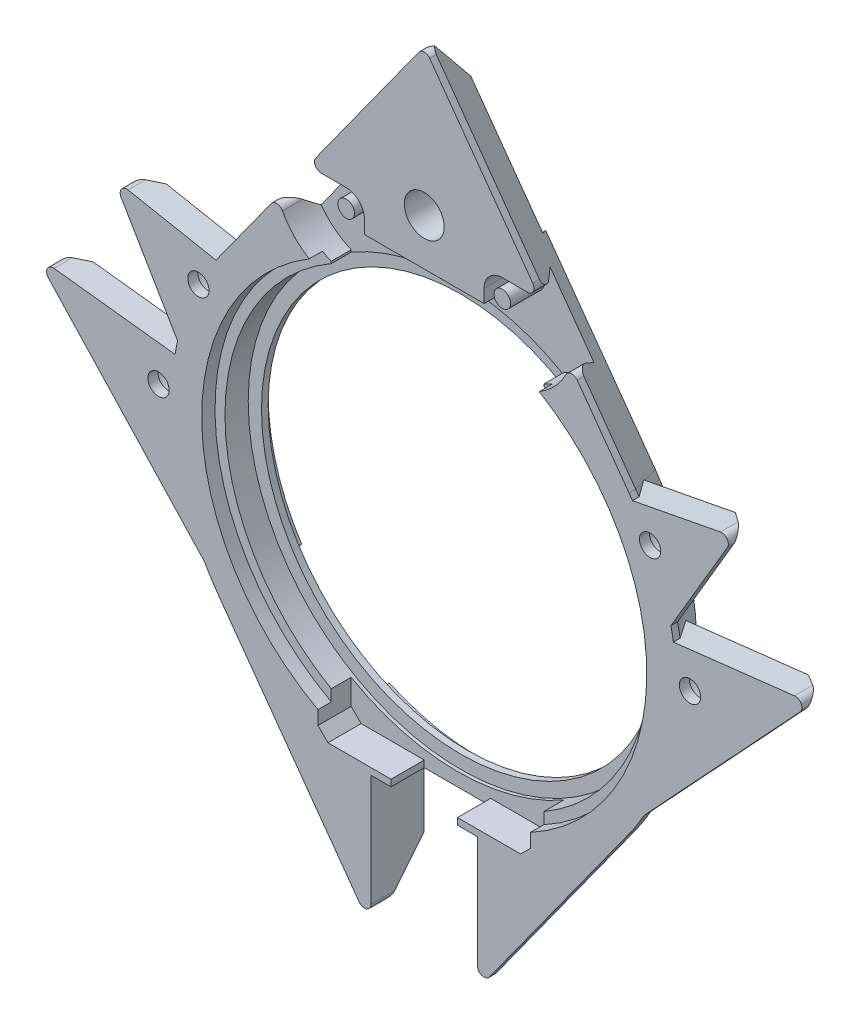
from build123d import *

# Parameters (mm, degrees)
SKETCH_1_R                = 30
EXTRUDE_1_DEPTH           = 8
CHAMFER_12_SIZE           = 7
CHAMFER_12_SIZE_2         = 5
SKETCH_11_R               = 31.5
CUT_EXTRUDE_1_DEPTH       = 1.5
EXTRUDE_5_DEPTH           = 4
EXTRUDE_5_2_DEPTH         = 4
EXTRUDE_5_3_DEPTH         = 4
EXTRUDE_5_4_DEPTH         = 4
CHAMFER_13_SIZE           = 3
CHAMFER_14_SIZE           = 3
CHAMFER_15_SIZE           = 3
CHAMFER_16_SIZE           = 3
SKETCH_36_W               = 32
SKETCH_36_H               = 70
CUT_EXTRUDE_17_DEPTH      = 5
SKETCH_13_W               = 16
SKETCH_13_H               = 31
CUT_EXTRUDE_2_DEPTH       = 87.190822204
SKETCH_24_R               = 32
CUT_EXTRUDE_8_DEPTH       = 5.5
CHAMFER_20_SIZE           = 2.5
CUT_EXTRUDE_19_REACH      = 88.191
SKETCH_37_R               = 1.5
SKETCH_37_R_2             = 1.25
CUT_EXTRUDE_9_DEPTH       = 86.911919035
CUT_EXTRUDE_9_DEPTH_BACK  = 2.5
SKETCH_25_R               = 3.5
HOLE_WIZARD_3_2_3_2_1_D   = 3.2
CUT_EXTRUDE_14_DEPTH      = 1
SKETCH_34_R               = 35
SKETCH_34_R_2             = 17.5
CUT_EXTRUDE_15_DEPTH      = 1
FILLET_1_R                = 1
SKETCH_38_W               = 9.5
SKETCH_38_H               = 1
EXTRUDE_6_DEPTH           = 5
CUT_EXTRUDE_20_DEPTH      = 87.10376201
CUT_EXTRUDE_20_DEPTH_BACK = 87.10376201
SKETCH_39_R               = 3
CHAMFER_21_SIZE           = 2
CUT_EXTRUDE_21_DEPTH      = 2
FILLET_2_R                = 1


with BuildPart() as part:
    # Эскиз1 → Бобышка-Вытянуть1 (new body)
    with BuildSketch(Plane.XY):
        with BuildLine():
            Line((30.829801919, 22.215384615), (0.811310577, 63.874089069))
            ThreePointArc((0.811310577, 63.874089069), (0, 64.289473684), (-0.811310577, 63.874089069))
            Line((-0.811310577, 63.874089069), (-30.829801919, 22.215384615))
            ThreePointArc((-30.829801919, 22.215384615), (-38, 0), (-30.829801919, -22.215384615))
            Line((-30.829801919, -22.215384615), (-0.811310577, -63.874089069))
            ThreePointArc((-0.811310577, -63.874089069), (0, -64.289473684), (0.811310577, -63.874089069))
            Line((0.811310577, -63.874089069), (30.829801919, -22.215384615))
            ThreePointArc((30.829801919, -22.215384615), (38, 0), (30.829801919, 22.215384615))
        make_face()
        Circle(SKETCH_1_R, mode=Mode.SUBTRACT)
    extrude(amount=EXTRUDE_1_DEPTH)

    # Фаска12
    # the kernel refuses this chamfer: 7, 5 mm, written as the material it takes off along each edge
    with BuildSketch(Plane(origin=(-30.829801919, -22.215384615, 0), x_dir=(-0.018263348031143992, -0.013160230543711323, 0.9997465971188547), z_dir=(0.5846153846153845, -0.8113105768267822, 0)), Plane(origin=(-9.755140998, -78.537873409, 0), x_dir=(0.018263348031143826, -0.013160230543711206, 0.9997465971188547), z_dir=(0.5846153846153846, 0.8113105768267822, 0)), Plane(origin=(9.755140998, 78.537873409, 0), x_dir=(-0.018263348031143992, 0.013160230543711323, 0.9997465971188547), z_dir=(-0.5846153846153845, -0.8113105768267822, 0)), Plane(origin=(30.829801919, 22.215384615, 0), x_dir=(0.018263348031143992, 0.013160230543711323, 0.9997465971188547), z_dir=(-0.5846153846153846, 0.8113105768267822, 0))) as chamfer_12_piece_1:
        Polygon((CHAMFER_12_SIZE * 0.999746597119, -CHAMFER_12_SIZE * 0.0225109206669), (-CHAMFER_12_SIZE_2 * 0.0225109206669, -CHAMFER_12_SIZE_2 * 0.999746597119), (0, 0), align=None)
    extrude(amount=69.421612884, mode=Mode.SUBTRACT)
    with BuildSketch(Plane(origin=(0, 0, 0), x_dir=(0.8113105768267822, -0.5846153846153845, 0), z_dir=(-0.5846153846153845, -0.8113105768267822, 0))) as chamfer_12_piece_2:
        Polygon((38, CHAMFER_12_SIZE), (38 - CHAMFER_12_SIZE_2, 0), (38, 0), align=None)
    revolve(axis=Axis((0, 0, 0), (0, 0, 1)), revolution_arc=71.551646689, mode=Mode.SUBTRACT)
    with BuildSketch(Plane(origin=(0, 0, 0), x_dir=(-0.8113105768267816, 0.5846153846153853, 0), z_dir=(0.5846153846153853, 0.8113105768267816, 0))) as chamfer_12_piece_3:
        Polygon((38, CHAMFER_12_SIZE), (38 - CHAMFER_12_SIZE_2, 0), (38, 0), align=None)
    revolve(axis=Axis((0, 0, 0), (0, 0, 1)), revolution_arc=71.551646689, mode=Mode.SUBTRACT)

    # Эскиз11 → Вырез-Вытянуть1 (cut)
    with BuildSketch(Plane(origin=(0, 0, 0), x_dir=(-1, 0, 0), z_dir=(0, 0, -1))):
        Circle(SKETCH_11_R)
    extrude(amount=-CUT_EXTRUDE_1_DEPTH, mode=Mode.SUBTRACT)


with BuildPart() as body_2:
    # Эскиз17 → Бобышка-Вытянуть5 (new body)
    with BuildSketch(Plane(origin=(0, 0, 8), x_dir=(-1, 0, 0), z_dir=(0, 0, -1))):
        with BuildLine():
            Line((27.658633372, -18), (31.430265195, -20.454545455))
            Line((31.430265195, -20.454545455), (56.580125307, 6.558267258))
            ThreePointArc((56.580125307, 6.558267258), (56.740609868, 7.690973443), (55.733168502, 8.233044002))
            Line((55.733168502, 8.233044002), (32.530722923, 5.545454545))
            ThreePointArc((32.530722923, 5.545454545), (32.315426041, -6.686795927), (27.658633372, -18))
        make_face()
    extrude(amount=EXTRUDE_5_DEPTH)

    # Фаска13
    # the kernel refuses this chamfer: 3 mm, written as the material it takes off along each edge
    with BuildSketch(Plane(origin=(-26.173087888, -26.101143304, 4), x_dir=(-0.020124066412995686, -0.01873619976382356, 0.9996219169112968), z_dir=(-0.6814185279188427, 0.73189397443135, 0))) as chamfer_13_piece_1:
        Polygon((CHAMFER_13_SIZE * 0.999621916911, CHAMFER_13_SIZE * 0.0274958766106), (-CHAMFER_13_SIZE * 0.0274958766106, CHAMFER_13_SIZE * 0.999621916911), (0, 0), align=None)
    extrude(amount=52.338193439, mode=Mode.SUBTRACT)


with BuildPart() as body_3:
    # Эскиз17 → Extrude 5 2 (new body)
    with BuildSketch(Plane(origin=(0, 0, 8), x_dir=(-1, 0, 0), z_dir=(0, 0, -1))):
        with BuildLine():
            Line((-31.430265195, -20.454545455), (-27.658633372, -18))
            ThreePointArc((-27.658633372, -18), (-32.315426041, -6.686795927), (-32.530722923, 5.545454545))
            Line((-32.530722923, 5.545454545), (-55.733168502, 8.233044002))
            ThreePointArc((-55.733168502, 8.233044002), (-56.740609868, 7.690973443), (-56.580125307, 6.558267258))
            Line((-56.580125307, 6.558267258), (-31.430265195, -20.454545455))
        make_face()
    extrude(amount=EXTRUDE_5_2_DEPTH)

    # Фаска14
    # the kernel refuses this chamfer: 3 mm, written as the material it takes off along each edge
    with BuildSketch(Plane(origin=(61.837302615, 12.204865107, 4), x_dir=(0.02012406641299663, -0.018736199763824447, 0.9996219169112968), z_dir=(-0.6814185279188428, -0.7318939744313497, 0))) as chamfer_14_piece_1:
        Polygon((CHAMFER_14_SIZE * 0.999621916911, CHAMFER_14_SIZE * 0.0274958766106), (-CHAMFER_14_SIZE * 0.0274958766106, CHAMFER_14_SIZE * 0.999621916911), (0, 0), align=None)
    extrude(amount=52.338193439, mode=Mode.SUBTRACT)


with BuildPart() as body_4:
    # Эскиз17 → Extrude 5 3 (new body)
    with BuildSketch(Plane(origin=(0, 0, 8), x_dir=(-1, 0, 0), z_dir=(0, 0, -1))):
        with BuildLine():
            ThreePointArc((25.909216128, 20.438016529), (29.943619234, 13.870099754), (32.34435074, 6.545454545))
            Line((32.34435074, 6.545454545), (36.754944023, 7.438016529))
            Line((36.754944023, 7.438016529), (45.633903711, 22.532247998))
            ThreePointArc((45.633903711, 22.532247998), (45.589131135, 23.615676709), (44.583521637, 24.021351321))
            Line((44.583521637, 24.021351321), (25.909216128, 20.438016529))
        make_face()
    extrude(amount=EXTRUDE_5_3_DEPTH)

    # Фаска16
    # the kernel refuses this chamfer: 3 mm, written as the material it takes off along each edge
    with BuildSketch(Plane(origin=(-32.843258921, 0.788151855, 4), x_dir=(-0.02369963682641979, -0.013940962839070477, 0.9996219169112968), z_dir=(-0.5070201265633943, 0.8619342151577694, 0))) as chamfer_16_piece_1:
        Polygon((CHAMFER_16_SIZE * 0.999621916911, CHAMFER_16_SIZE * 0.0274958766106), (-CHAMFER_16_SIZE * 0.0274958766106, CHAMFER_16_SIZE * 0.999621916911), (0, 0), align=None)
    extrude(amount=32.942143747, mode=Mode.SUBTRACT)


with BuildPart() as body_5:
    # Эскиз17 → Extrude 5 4 (new body)
    with BuildSketch(Plane(origin=(0, 0, 8), x_dir=(-1, 0, 0), z_dir=(0, 0, -1))):
        with BuildLine():
            Line((-36.754944023, 7.438016529), (-32.34435074, 6.545454545))
            ThreePointArc((-32.34435074, 6.545454545), (-29.943619234, 13.870099754), (-25.909216128, 20.438016529))
            Line((-25.909216128, 20.438016529), (-44.583521637, 24.021351321))
            ThreePointArc((-44.583521637, 24.021351321), (-45.589131135, 23.615676709), (-45.633903711, 22.532247998))
            Line((-45.633903711, 22.532247998), (-36.754944023, 7.438016529))
        make_face()
    extrude(amount=EXTRUDE_5_4_DEPTH)

    # Фаска15
    # the kernel refuses this chamfer: 3 mm, written as the material it takes off along each edge
    with BuildSketch(Plane(origin=(49.545588813, 29.182112672, 4), x_dir=(0.02369963682642022, -0.013940962839070741, 0.9996219169112968), z_dir=(-0.5070201265633945, -0.8619342151577692, 0))) as chamfer_15_piece_1:
        Polygon((CHAMFER_15_SIZE * 0.999621916911, CHAMFER_15_SIZE * 0.0274958766106), (-CHAMFER_15_SIZE * 0.0274958766106, CHAMFER_15_SIZE * 0.999621916911), (0, 0), align=None)
    extrude(amount=32.942143747, mode=Mode.SUBTRACT)


with BuildPart() as body_2_1:
    add(body_2.part)

    # Combine 2: union body 3, body 5, body 4, part
    add(body_3.part)
    add(body_5.part)
    add(body_4.part)
    add(part.part)

    # Эскиз36 → Вырез-Вытянуть17 (cut)
    with BuildSketch(Plane.XY.offset(8)):
        with Locations((0, 1)):
            Rectangle(SKETCH_36_W, SKETCH_36_H)
    extrude(amount=-CUT_EXTRUDE_17_DEPTH, mode=Mode.SUBTRACT)

    # Эскиз13 → Вырез-Вытянуть2 (cut, through all)
    with BuildSketch(Plane.XY.offset(8)):
        with Locations((0, -49.5)):
            Rectangle(SKETCH_13_W, SKETCH_13_H)
    extrude(amount=-CUT_EXTRUDE_2_DEPTH, mode=Mode.SUBTRACT)

    # Эскиз24 → Вырез-Вытянуть8 (cut)
    with BuildSketch(Plane.XY.offset(8)):
        with Locations(Location((0, 0, 0), (0, 0, 60))):
            Circle(SKETCH_24_R)
    extrude(amount=-CUT_EXTRUDE_8_DEPTH, mode=Mode.SUBTRACT)

    # Фаска20
    chamfer_20_edges = [body_2_1.edges().sort_by_distance(p)[0] for p in [
        (16, -34, 5.5),
        (16, 36, 5.5),
        (-16, 36, 5.5),
        (-16, -34, 5.5),
    ]]
    chamfer(chamfer_20_edges, length=CHAMFER_20_SIZE)

    # Вырез-Вытянуть19: up to this face of the body (flat: up to its plane)
    cut_extrude_19_end = Plane(body_2_1.part.faces().sort_by_distance((0, 33.081879447, 3))[0])
    # Эскиз37 → Вырез-Вытянуть19 (cut, up to the picked face)
    with BuildSketch(Plane.XY.offset(8), mode=Mode.PRIVATE) as cut_extrude_19_sk1:
        with BuildLine():
            Line((17.474101142, 40.75), (11.75, 40.75))
            ThreePointArc((11.75, 40.75), (13.694543648, 39.944543648), (14.5, 38))
            ThreePointArc((14.5, 38), (14.255512428, 36.866462407), (13.565521837, 35.934478163))
            Line((13.565521837, 35.934478163), (16, 33.5))
            Line((16, 33.5), (16, 28.012507822))
            ThreePointArc((16, 28.012507822), (19.687902157, 30.597148566), (22.009323549, 34.456163053))
            Line((22.009323549, 34.456163053), (17.474101142, 40.75))
        make_face()
    cut_extrude_19_tool1 = split(extrude(cut_extrude_19_sk1.sketch, amount=-CUT_EXTRUDE_19_REACH, mode=Mode.PRIVATE), bisect_by=cut_extrude_19_end, keep=Keep.BOTH, mode=Mode.PRIVATE)
    # Эскиз37 → Вырез-Вытянуть19 (cut, up to the picked face)
    with BuildSketch(Plane.XY.offset(8), mode=Mode.PRIVATE) as cut_extrude_19_sk2:
        with BuildLine():
            Line((9.862541391, 36), (9, 36))
            Line((9, 36), (9, 27.5))
            ThreePointArc((9, 27.5), (12.542569282, 27.174828688), (16, 28.012507822))
            Line((16, 28.012507822), (16, 33.5))
            Line((16, 33.5), (13.565521837, 35.934478163))
            ThreePointArc((13.565521837, 35.934478163), (11.701348149, 35.250430398), (9.862541391, 36))
        make_face()
    cut_extrude_19_tool2 = split(extrude(cut_extrude_19_sk2.sketch, amount=-CUT_EXTRUDE_19_REACH, mode=Mode.PRIVATE), bisect_by=cut_extrude_19_end, keep=Keep.BOTH, mode=Mode.PRIVATE)
    # Эскиз37 → Вырез-Вытянуть19 (cut, up to the picked face)
    with BuildSketch(Plane.XY.offset(8), mode=Mode.PRIVATE) as cut_extrude_19_sk3:
        with BuildLine():
            Line((9, 38), (9, 36))
            Line((9, 36), (9.862541391, 36))
            ThreePointArc((9.862541391, 36), (9.224825632, 36.910966294), (9, 38))
        make_face()
    cut_extrude_19_tool3 = split(extrude(cut_extrude_19_sk3.sketch, amount=-CUT_EXTRUDE_19_REACH, mode=Mode.PRIVATE), bisect_by=cut_extrude_19_end, keep=Keep.BOTH, mode=Mode.PRIVATE)
    # Эскиз37 → Вырез-Вытянуть19 (cut, up to the picked face)
    with BuildSketch(Plane.XY.offset(8), mode=Mode.PRIVATE) as cut_extrude_19_sk4:
        with BuildLine():
            ThreePointArc((11.75, 40.75), (9.805456352, 39.944543648), (9, 38))
            ThreePointArc((9, 38), (9.224825632, 36.910966294), (9.862541391, 36))
            Line((9.862541391, 36), (10.25, 36))
            ThreePointArc((10.25, 36), (10.631966011, 40.236067977), (14.25, 38))
            ThreePointArc((14.25, 38), (13.986067977, 36.881966011), (13.25, 36))
            Line((13.25, 36), (13.5, 36))
            Line((13.5, 36), (13.565521837, 35.934478163))
            ThreePointArc((13.565521837, 35.934478163), (14.255512428, 36.866462407), (14.5, 38))
            ThreePointArc((14.5, 38), (13.694543648, 39.944543648), (11.75, 40.75))
        make_face()
    cut_extrude_19_tool4 = split(extrude(cut_extrude_19_sk4.sketch, amount=-CUT_EXTRUDE_19_REACH, mode=Mode.PRIVATE), bisect_by=cut_extrude_19_end, keep=Keep.BOTH, mode=Mode.PRIVATE)
    # Эскиз37 → Вырез-Вытянуть19 (cut, up to the picked face)
    with BuildSketch(Plane.XY.offset(8), mode=Mode.PRIVATE) as cut_extrude_19_sk5:
        with BuildLine():
            Line((10.25, 36), (9.862541391, 36))
            ThreePointArc((9.862541391, 36), (11.701348149, 35.250430398), (13.565521837, 35.934478163))
            Line((13.565521837, 35.934478163), (13.5, 36))
            Line((13.5, 36), (13.25, 36))
            ThreePointArc((13.25, 36), (11.75, 35.5), (10.25, 36))
        make_face()
    cut_extrude_19_tool5 = split(extrude(cut_extrude_19_sk5.sketch, amount=-CUT_EXTRUDE_19_REACH, mode=Mode.PRIVATE), bisect_by=cut_extrude_19_end, keep=Keep.BOTH, mode=Mode.PRIVATE)
    # Эскиз37 → Вырез-Вытянуть19 (cut, up to the picked face)
    with BuildSketch(Plane.XY.offset(8), mode=Mode.PRIVATE) as cut_extrude_19_sk6:
        with BuildLine():
            ThreePointArc((11.75, 40.75), (9.805456352, 39.944543648), (9, 38))
            ThreePointArc((9, 38), (9.224825632, 36.910966294), (9.862541391, 36))
            Line((9.862541391, 36), (10.25, 36))
            ThreePointArc((10.25, 36), (10.631966011, 40.236067977), (14.25, 38))
            ThreePointArc((14.25, 38), (13.986067977, 36.881966011), (13.25, 36))
            Line((13.25, 36), (13.5, 36))
            Line((13.5, 36), (13.565521837, 35.934478163))
            ThreePointArc((13.565521837, 35.934478163), (14.255512428, 36.866462407), (14.5, 38))
            ThreePointArc((14.5, 38), (13.694543648, 39.944543648), (11.75, 40.75))
        make_face()
    cut_extrude_19_tool6 = split(extrude(cut_extrude_19_sk6.sketch, amount=-CUT_EXTRUDE_19_REACH, mode=Mode.PRIVATE), bisect_by=cut_extrude_19_end, keep=Keep.BOTH, mode=Mode.PRIVATE)
    # Эскиз37 → Вырез-Вытянуть19 (cut, up to the picked face)
    with BuildSketch(Plane.XY.offset(8), mode=Mode.PRIVATE) as cut_extrude_19_sk7:
        with BuildLine():
            Line((10.25, 36), (9.862541391, 36))
            ThreePointArc((9.862541391, 36), (11.701348149, 35.250430398), (13.565521837, 35.934478163))
            Line((13.565521837, 35.934478163), (13.5, 36))
            Line((13.5, 36), (13.25, 36))
            ThreePointArc((13.25, 36), (11.75, 35.5), (10.25, 36))
        make_face()
    cut_extrude_19_tool7 = split(extrude(cut_extrude_19_sk7.sketch, amount=-CUT_EXTRUDE_19_REACH, mode=Mode.PRIVATE), bisect_by=cut_extrude_19_end, keep=Keep.BOTH, mode=Mode.PRIVATE)
    # Эскиз37 → Вырез-Вытянуть19 (cut, up to the picked face)
    with BuildSketch(Plane.XY.offset(8), mode=Mode.PRIVATE) as cut_extrude_19_sk8:
        with BuildLine():
            ThreePointArc((-13.565521837, 35.934478163), (-14.323196947, 38.97013271), (-11.75, 40.75))
            Line((-11.75, 40.75), (-17.474101142, 40.75))
            Line((-17.474101142, 40.75), (-22.009323549, 34.456163053))
            ThreePointArc((-22.009323549, 34.456163053), (-19.687902157, 30.597148566), (-16, 28.012507822))
            Line((-16, 28.012507822), (-16, 33.5))
            Line((-16, 33.5), (-13.565521837, 35.934478163))
        make_face()
    cut_extrude_19_tool8 = split(extrude(cut_extrude_19_sk8.sketch, amount=-CUT_EXTRUDE_19_REACH, mode=Mode.PRIVATE), bisect_by=cut_extrude_19_end, keep=Keep.BOTH, mode=Mode.PRIVATE)
    # Эскиз37 → Вырез-Вытянуть19 (cut, up to the picked face)
    with BuildSketch(Plane.XY.offset(8), mode=Mode.PRIVATE) as cut_extrude_19_sk9:
        with BuildLine():
            ThreePointArc((-9, 38), (-9.805456352, 39.944543648), (-11.75, 40.75))
            ThreePointArc((-11.75, 40.75), (-14.323196947, 38.97013271), (-13.565521837, 35.934478163))
            Line((-13.565521837, 35.934478163), (-13.5, 36))
            Line((-13.5, 36), (-13.25, 36))
            ThreePointArc((-13.25, 36), (-12.868033989, 40.236067977), (-9.25, 38))
            ThreePointArc((-9.25, 38), (-9.513932023, 36.881966011), (-10.25, 36))
            Line((-10.25, 36), (-9.862541391, 36))
            ThreePointArc((-9.862541391, 36), (-9.224825632, 36.910966294), (-9, 38))
        make_face()
    cut_extrude_19_tool9 = split(extrude(cut_extrude_19_sk9.sketch, amount=-CUT_EXTRUDE_19_REACH, mode=Mode.PRIVATE), bisect_by=cut_extrude_19_end, keep=Keep.BOTH, mode=Mode.PRIVATE)
    # Эскиз37 → Вырез-Вытянуть19 (cut, up to the picked face)
    with BuildSketch(Plane.XY.offset(8), mode=Mode.PRIVATE) as cut_extrude_19_sk10:
        with BuildLine():
            Line((-13.5, 36), (-13.565521837, 35.934478163))
            ThreePointArc((-13.565521837, 35.934478163), (-11.701348149, 35.250430398), (-9.862541391, 36))
            Line((-9.862541391, 36), (-10.25, 36))
            ThreePointArc((-10.25, 36), (-11.75, 35.5), (-13.25, 36))
            Line((-13.25, 36), (-13.5, 36))
        make_face()
    cut_extrude_19_tool10 = split(extrude(cut_extrude_19_sk10.sketch, amount=-CUT_EXTRUDE_19_REACH, mode=Mode.PRIVATE), bisect_by=cut_extrude_19_end, keep=Keep.BOTH, mode=Mode.PRIVATE)
    # Эскиз37 → Вырез-Вытянуть19 (cut, up to the picked face)
    with BuildSketch(Plane.XY.offset(8), mode=Mode.PRIVATE) as cut_extrude_19_sk11:
        with BuildLine():
            Line((-13.25, 36), (-10.25, 36))
            ThreePointArc((-10.25, 36), (-9.513932023, 36.881966011), (-9.25, 38))
            ThreePointArc((-9.25, 38), (-12.868033989, 40.236067977), (-13.25, 36))
        make_face()
        with Locations((-11.75, 38)):
            Circle(SKETCH_37_R, mode=Mode.SUBTRACT)
    cut_extrude_19_tool11 = split(extrude(cut_extrude_19_sk11.sketch, amount=-CUT_EXTRUDE_19_REACH, mode=Mode.PRIVATE), bisect_by=cut_extrude_19_end, keep=Keep.BOTH, mode=Mode.PRIVATE)
    # Эскиз37 → Вырез-Вытянуть19 (cut, up to the picked face)
    with BuildSketch(Plane.XY.offset(8), mode=Mode.PRIVATE) as cut_extrude_19_sk12:
        with Locations((-11.75, 38)):
            Circle(SKETCH_37_R)
        with Locations((-11.75, 38)):
            Circle(SKETCH_37_R_2, mode=Mode.SUBTRACT)
    cut_extrude_19_tool12 = split(extrude(cut_extrude_19_sk12.sketch, amount=-CUT_EXTRUDE_19_REACH, mode=Mode.PRIVATE), bisect_by=cut_extrude_19_end, keep=Keep.BOTH, mode=Mode.PRIVATE)
    # Эскиз37 → Вырез-Вытянуть19 (cut, up to the picked face)
    with BuildSketch(Plane.XY.offset(8), mode=Mode.PRIVATE) as cut_extrude_19_sk13:
        with BuildLine():
            Line((-9, 36), (-9, 38))
            ThreePointArc((-9, 38), (-9.224825632, 36.910966294), (-9.862541391, 36))
            Line((-9.862541391, 36), (-9, 36))
        make_face()
    cut_extrude_19_tool13 = split(extrude(cut_extrude_19_sk13.sketch, amount=-CUT_EXTRUDE_19_REACH, mode=Mode.PRIVATE), bisect_by=cut_extrude_19_end, keep=Keep.BOTH, mode=Mode.PRIVATE)
    # Эскиз37 → Вырез-Вытянуть19 (cut, up to the picked face)
    with BuildSketch(Plane.XY.offset(8), mode=Mode.PRIVATE) as cut_extrude_19_sk14:
        with BuildLine():
            ThreePointArc((14.25, 38), (10.631966011, 40.236067977), (10.25, 36))
            Line((10.25, 36), (13.25, 36))
            ThreePointArc((13.25, 36), (13.986067977, 36.881966011), (14.25, 38))
        make_face()
        with Locations((11.75, 38)):
            Circle(SKETCH_37_R, mode=Mode.SUBTRACT)
    cut_extrude_19_tool14 = split(extrude(cut_extrude_19_sk14.sketch, amount=-CUT_EXTRUDE_19_REACH, mode=Mode.PRIVATE), bisect_by=cut_extrude_19_end, keep=Keep.BOTH, mode=Mode.PRIVATE)
    # Эскиз37 → Вырез-Вытянуть19 (cut, up to the picked face)
    with BuildSketch(Plane.XY.offset(8), mode=Mode.PRIVATE) as cut_extrude_19_sk15:
        with Locations((11.75, 38)):
            Circle(SKETCH_37_R)
        with Locations((11.75, 38)):
            Circle(SKETCH_37_R_2, mode=Mode.SUBTRACT)
    cut_extrude_19_tool15 = split(extrude(cut_extrude_19_sk15.sketch, amount=-CUT_EXTRUDE_19_REACH, mode=Mode.PRIVATE), bisect_by=cut_extrude_19_end, keep=Keep.BOTH, mode=Mode.PRIVATE)
    add(cut_extrude_19_tool1.solids().sort_by(Axis((17.546246, 35.092677, 8), (0, 0, -1)))[0], mode=Mode.SUBTRACT)
    add(cut_extrude_19_tool2.solids().sort_by(Axis((12.339028, 31.341698, 8), (0, 0, -1)))[0], mode=Mode.SUBTRACT)
    add(cut_extrude_19_tool3.solids().sort_by(Axis((9.24993, 36.48296, 8), (0, 0, -1)))[0], mode=Mode.SUBTRACT)
    add(cut_extrude_19_tool4.solids().sort_by(Axis((14.188909, 36.896595, 8), (0, 0, -1)))[0], mode=Mode.SUBTRACT)
    add(cut_extrude_19_tool5.solids().sort_by(Axis((13.506045, 35.940523, 8), (0, 0, -1)))[0], mode=Mode.SUBTRACT)
    add(cut_extrude_19_tool6.solids().sort_by(Axis((14.188909, 36.896595, 8), (0, 0, -1)))[0], mode=Mode.SUBTRACT)
    add(cut_extrude_19_tool7.solids().sort_by(Axis((13.506045, 35.940523, 8), (0, 0, -1)))[0], mode=Mode.SUBTRACT)
    add(cut_extrude_19_tool8.solids().sort_by(Axis((-17.546246, 35.092677, 8), (0, 0, -1)))[0], mode=Mode.SUBTRACT)
    add(cut_extrude_19_tool9.solids().sort_by(Axis((-9.291951, 36.939916, 8), (0, 0, -1)))[0], mode=Mode.SUBTRACT)
    add(cut_extrude_19_tool10.solids().sort_by(Axis((-10.056271, 35.962218, 8), (0, 0, -1)))[0], mode=Mode.SUBTRACT)
    add(cut_extrude_19_tool11.solids().sort_by(Axis((-11.75, 36.067268, 8), (0, 0, -1)))[0], mode=Mode.SUBTRACT)
    add(cut_extrude_19_tool12.solids().sort_by(Axis((-13.207574, 38, 8), (0, 0, -1)))[0], mode=Mode.SUBTRACT)
    add(cut_extrude_19_tool13.solids().sort_by(Axis((-9.24993, 36.48296, 8), (0, 0, -1)))[0], mode=Mode.SUBTRACT)
    add(cut_extrude_19_tool14.solids().sort_by(Axis((13.925902, 36.912049, 8), (0, 0, -1)))[0], mode=Mode.SUBTRACT)
    add(cut_extrude_19_tool15.solids().sort_by(Axis((10.292426, 38, 8), (0, 0, -1)))[0], mode=Mode.SUBTRACT)

    # Эскиз25 → Вырез-Вытянуть9 (cut, two sides: drawn at the far end of the back side and taken through both)
    with BuildSketch(Plane(origin=(0, 0, 4), x_dir=(-1, 0, 0), z_dir=(0, 0, -1)).offset(-CUT_EXTRUDE_9_DEPTH_BACK)):
        with Locations(Location((-34, 17, 0), (0, 0, 283.568395227))):
            Circle(SKETCH_25_R)
        with Locations(Location((-40, 1, 0), (0, 0, 180))):
            Circle(SKETCH_25_R)
        with Locations(Location((34, 17, 0), (0, 0, 156.698497582))):
            Circle(SKETCH_25_R)
        with Locations(Location((40, 1, 0), (0, 0, 180))):
            Circle(SKETCH_25_R)
    extrude(amount=CUT_EXTRUDE_9_DEPTH + CUT_EXTRUDE_9_DEPTH_BACK, mode=Mode.SUBTRACT)

    # Диаметр отверстия Ø3.2 (3.2)1 (through all)
    with Locations(Plane(origin=(0, 0, 6.5), x_dir=(-1, 0, 0), z_dir=(0, 0, -1))):
        with Locations((-34, 17), (-40, 1), (34, 17), (40, 1)):
            Hole(HOLE_WIZARD_3_2_3_2_1_D / 2)

    # Эскиз33 → Вырез-Вытянуть14 (cut)
    with BuildSketch(Plane(origin=(0, 0, 0), x_dir=(-1, 0, 0), z_dir=(0, 0, -1))):
        with BuildLine():
            Line((-14.395430735, 45.022480556), (0, 65))
            Line((0, 65), (14.395430735, 45.022480556))
            ThreePointArc((14.395430735, 45.022480556), (7.024876919, 39.121099102), (1.5, 31.464265445))
            ThreePointArc((1.5, 31.464265445), (0, 31.5), (-1.5, 31.464265445))
            ThreePointArc((-1.5, 31.464265445), (-7.024876919, 39.121099102), (-14.395430735, 45.022480556))
        make_face()
    extrude(amount=-CUT_EXTRUDE_14_DEPTH, mode=Mode.SUBTRACT)

    # Эскиз34 → Вырез-Вытянуть15 (cut)
    with BuildSketch(Plane(origin=(0, 0, 0), x_dir=(-1, 0, 0), z_dir=(0, 0, -1))):
        with Locations((0, -40)):
            Circle(SKETCH_34_R)
        with Locations((0, -40)):
            Circle(SKETCH_34_R_2, mode=Mode.SUBTRACT)
    extrude(amount=-CUT_EXTRUDE_15_DEPTH, mode=Mode.SUBTRACT)

    # Скругление1
    fillet_1_edges = [body_2_1.edges().sort_by_distance(p)[0] for p in [
        (-8, -53.897855264, 7.5),
        (8, -53.897855264, 7.5),
    ]]
    fillet(fillet_1_edges, radius=FILLET_1_R)

    # Эскиз38 → Бобышка-Вытянуть6 (add)
    with BuildSketch(Plane.XY.offset(3)):
        with Locations((-9.75, -33.5)):
            Rectangle(SKETCH_38_W, SKETCH_38_H)
        with Locations((9.75, -33.5)):
            Rectangle(SKETCH_38_W, SKETCH_38_H)
    extrude(amount=EXTRUDE_6_DEPTH)

    # Эскиз39 → Вырез-Вытянуть20 (cut, two sides: drawn at the far end of the back side and taken through both)
    with BuildSketch(Plane(origin=(0, 0, 1), x_dir=(-1, 0, 0), z_dir=(0, 0, -1)).offset(-CUT_EXTRUDE_20_DEPTH_BACK)):
        with Locations((0, 43)):
            Circle(SKETCH_39_R)
    extrude(amount=CUT_EXTRUDE_20_DEPTH + CUT_EXTRUDE_20_DEPTH_BACK, mode=Mode.SUBTRACT)

    # Фаска21
    chamfer_21_edges = [body_2_1.edges().sort_by_distance(p)[0] for p in [
        (3, 43, 1),
    ]]
    chamfer(chamfer_21_edges, length=CHAMFER_21_SIZE)

    # Эскиз40 → Вырез-Вытянуть21 (cut)
    with BuildSketch(Plane.XY.offset(8)):
        with BuildLine():
            ThreePointArc((33.5, 0), (-17.156491177, 28.773335061), (-15.927152866, -29.471610095))
            Line((-15.927152866, -29.471610095), (-12.466924177, -29.471610095))
            ThreePointArc((-12.466924177, -29.471610095), (-17.678495784, 26.673409734), (32, 0))
            ThreePointArc((32, 0), (26.673409734, -17.678495784), (12.466924177, -29.471610095))
            Line((12.466924177, -29.471610095), (15.927152866, -29.471610095))
            ThreePointArc((15.927152866, -29.471610095), (28.773335061, -17.156491177), (33.5, 0))
        make_face()
    extrude(amount=-CUT_EXTRUDE_21_DEPTH, mode=Mode.SUBTRACT)

    # Скругление2
    fillet_2_edges = [body_2_1.edges().sort_by_distance(p)[0] for p in [
        (17.474101142, 40.75, 7.5),
        (22.009323549, 34.456163053, 7.5),
        (-22.009323549, 34.456163053, 7.5),
        (-17.474101142, 40.75, 7.5),
    ]]
    fillet(fillet_2_edges, radius=FILLET_2_R)


solid = body_2_1.part
